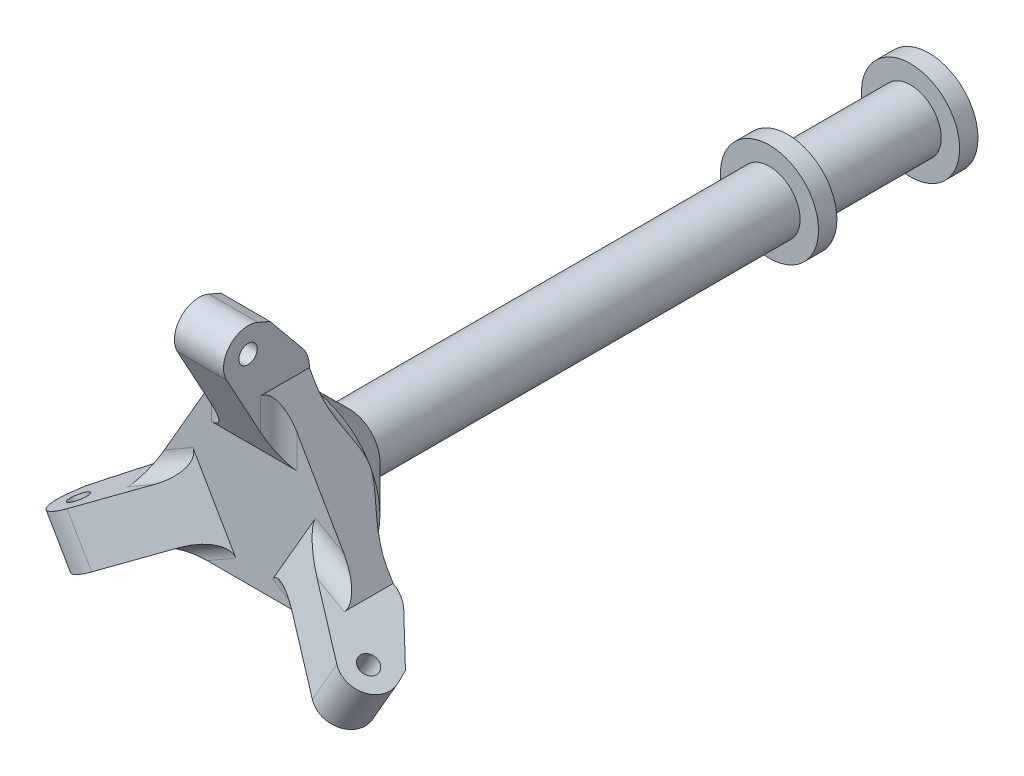
from build123d import *

# Parameters (mm, degrees)
EXTRUDE_1_DEPTH          = 5
SKETCH_3_R               = 1.5
EXTRUDE_2_DEPTH          = 4
CUT_EXTRUDE_1_DEPTH      = 112.469065397
PATTERN_CIRCULAR_1_COUNT = 3
FILLET_1_R               = 3
FILLET_2_R               = 5


with BuildPart() as part:
    # 草图1 → 旋转1 (revolve)
    with BuildSketch(Plane(origin=(0, 0, 0), x_dir=(0, 0, -1), z_dir=(1, 0, 0)), mode=Mode.PRIVATE) as revolve_1_sk:
        Polygon((0, 0), (0, 12.5), (3, 12.5), (10.5, 5), (79, 5), (79, 8), (82, 8), (82, 5), (102, 5), (102, 8), (105, 8), (105, 0), align=None)
    revolve(revolve_1_sk.sketch.rotate(Axis((0, 0, 0), (0, 0, -1)), 90), axis=Axis((0, 0, 0), (0, 0, -1)))

    # 草图2 → 凸台-拉伸1 (add)
    with BuildSketch(Plane.XY):
        Polygon((-4, 25), (4, 25), (4, 18.07179677), (17.650635095, -5.57179677), (23.650635095, -9.035898385), (19.650635095, -15.964101615), (13.650635095, -12.5), (-13.650635095, -12.5), (-19.650635095, -15.964101615), (-23.650635095, -9.035898385), (-17.650635095, -5.57179677), (-4, 18.07179677), align=None)
    extrude(amount=EXTRUDE_1_DEPTH)

    # 草图3 → 凸台-拉伸2 (add, symmetric)
    with BuildSketch(Plane(origin=(0, 0, 0), x_dir=(0, 0, -1), z_dir=(1, 0, 0))):
        with BuildLine():
            Line((-5, 7.5), (-13.510549927, 23.082700021))
            ThreePointArc((-13.510549927, 23.082700021), (-12.95059807, 27.700735275), (-8.4, 28.666060556))
            Line((-8.4, 28.666060556), (0, 25))
            Line((0, 25), (-5, 25))
            Line((-5, 25), (-5, 7.5))
        make_face()
        with Locations((-10, 25)):
            Circle(SKETCH_3_R, mode=Mode.SUBTRACT)
    extrude_2 = extrude(amount=EXTRUDE_2_DEPTH, both=True)

    # 草图5 → 切除-拉伸1 (cut, symmetric)
    with BuildSketch(Plane(origin=(0, 0, 0), x_dir=(0, 0, -1), z_dir=(1, 0, 0))):
        Polygon((0, 20), (-6.415605973, 27.8), (0, 25), align=None)
    cut_extrude_1 = extrude(amount=CUT_EXTRUDE_1_DEPTH, both=True, mode=Mode.SUBTRACT)

    # 阵列(圆周)1: 凸台-拉伸2, 切除-拉伸1 ×3 about axis
    pattern_circular_1_axis = Axis((0, 0, 0), (0, 0, 1))
    add([extrude_2.rotate(pattern_circular_1_axis, i * 360 / PATTERN_CIRCULAR_1_COUNT) for i in range(1, PATTERN_CIRCULAR_1_COUNT)])
    add([cut_extrude_1.rotate(pattern_circular_1_axis, i * 360 / PATTERN_CIRCULAR_1_COUNT) for i in range(1, PATTERN_CIRCULAR_1_COUNT)], mode=Mode.SUBTRACT)

    # 圆角1
    # the kernel refuses this fillet: 3 mm, written as the material it adds along each edge
    with BuildSketch(Plane(origin=(20.145825623, -16.25, 5), x_dir=(0, 0, 1), z_dir=(-0.8660254037844384, 0.5000000000000004, 0))) as fillet_1_piece_1_section:
        with BuildLine():
            CenterArc((FILLET_1_R, -FILLET_1_R), FILLET_1_R, 90, 90)
            Line((0, -FILLET_1_R), (0, 0))
            Line((0, 0), (FILLET_1_R, 0))
        make_face()
    fillet_1_piece_1 = extrude(amount=25.57179677, mode=Mode.PRIVATE)
    fillet_1_piece_1 = split(fillet_1_piece_1, bisect_by=Plane(origin=(20.145825623, -12.5, 5), z_dir=(0, 1, 0)), keep=Keep.TOP, mode=Mode.PRIVATE)
    fillet_1_piece_1 = split(fillet_1_piece_1, bisect_by=Plane(origin=(16.550053856, -14.173980202, 12.602327469), z_dir=(0.4151076221534179, -0.23966249739294157, -0.877637481750588)), keep=Keep.TOP, mode=Mode.PRIVATE)
    add(fillet_1_piece_1)
    with BuildSketch(Plane(origin=(24.145825623, -9.32179677, 5), x_dir=(0, 0, 1), z_dir=(-0.8660254037844384, 0.5000000000000004, 0))) as fillet_1_piece_2_section:
        with BuildLine():
            CenterArc((FILLET_1_R, FILLET_1_R), FILLET_1_R, 180, 90)
            Line((0, FILLET_1_R), (0, 0))
            Line((0, 0), (FILLET_1_R, 0))
        make_face()
    fillet_1_piece_2 = extrude(amount=25.57179677, mode=Mode.PRIVATE)
    fillet_1_piece_2 = split(fillet_1_piece_2, bisect_by=Plane(origin=(20.550053856, -7.245776972, 12.602327469), z_dir=(0.4151076221534179, -0.23966249739294157, -0.877637481750588)), keep=Keep.TOP, mode=Mode.PRIVATE)
    fillet_1_piece_2 = split(fillet_1_piece_2, bisect_by=Plane(origin=(20.898230359, -11.19679677, 5), z_dir=(-0.8660254037844386, -0.5000000000000001, 0)), keep=Keep.TOP, mode=Mode.PRIVATE)
    add(fillet_1_piece_2)
    with BuildSketch(Plane(origin=(4, 25.57179677, 5), x_dir=(0, 0, 1), z_dir=(0, -1, 0))) as fillet_1_piece_3_section:
        with BuildLine():
            CenterArc((FILLET_1_R, -FILLET_1_R), FILLET_1_R, 90, 90)
            Line((0, -FILLET_1_R), (0, 0))
            Line((0, 0), (FILLET_1_R, 0))
        make_face()
    fillet_1_piece_3 = extrude(amount=25.57179677, mode=Mode.PRIVATE)
    fillet_1_piece_3 = split(fillet_1_piece_3, bisect_by=Plane(origin=(0.752404736, 23.69679677, 5), z_dir=(-0.8660254037844386, -0.5000000000000001, 0)), keep=Keep.TOP, mode=Mode.PRIVATE)
    fillet_1_piece_3 = split(fillet_1_piece_3, bisect_by=Plane(origin=(4, 21.419757175, 12.602327469), z_dir=(0, 0.4793249947858827, -0.877637481750588)), keep=Keep.TOP, mode=Mode.PRIVATE)
    add(fillet_1_piece_3)
    with BuildSketch(Plane(origin=(-4, 25.57179677, 5), x_dir=(0, 0, 1), z_dir=(0, -1, 0))) as fillet_1_piece_4_section:
        with BuildLine():
            CenterArc((FILLET_1_R, FILLET_1_R), FILLET_1_R, 180, 90)
            Line((0, FILLET_1_R), (0, 0))
            Line((0, 0), (FILLET_1_R, 0))
        make_face()
    fillet_1_piece_4 = extrude(amount=25.57179677, mode=Mode.PRIVATE)
    fillet_1_piece_4 = split(fillet_1_piece_4, bisect_by=Plane(origin=(-0.752404736, 23.69679677, 5), z_dir=(0.8660254037844388, -0.4999999999999999, 0)), keep=Keep.TOP, mode=Mode.PRIVATE)
    fillet_1_piece_4 = split(fillet_1_piece_4, bisect_by=Plane(origin=(-4, 21.419757175, 12.602327469), z_dir=(0, 0.4793249947858827, -0.877637481750588)), keep=Keep.TOP, mode=Mode.PRIVATE)
    add(fillet_1_piece_4)
    with BuildSketch(Plane(origin=(-24.145825623, -9.32179677, 5), x_dir=(0, 0, 1), z_dir=(0.8660254037844388, 0.49999999999999983, 0))) as fillet_1_piece_5_section:
        with BuildLine():
            CenterArc((FILLET_1_R, -FILLET_1_R), FILLET_1_R, 90, 90)
            Line((0, -FILLET_1_R), (0, 0))
            Line((0, 0), (FILLET_1_R, 0))
        make_face()
    fillet_1_piece_5 = extrude(amount=25.57179677, mode=Mode.PRIVATE)
    fillet_1_piece_5 = split(fillet_1_piece_5, bisect_by=Plane(origin=(-20.898230359, -11.19679677, 5), z_dir=(0.8660254037844388, -0.4999999999999999, 0)), keep=Keep.TOP, mode=Mode.PRIVATE)
    fillet_1_piece_5 = split(fillet_1_piece_5, bisect_by=Plane(origin=(-20.550053856, -7.245776972, 12.602327469), z_dir=(-0.4151076221534181, -0.23966249739294126, -0.8776374817505879)), keep=Keep.TOP, mode=Mode.PRIVATE)
    add(fillet_1_piece_5)
    with BuildSketch(Plane(origin=(-20.145825623, -16.25, 5), x_dir=(0, 0, 1), z_dir=(0.8660254037844388, 0.49999999999999983, 0))) as fillet_1_piece_6_section:
        with BuildLine():
            CenterArc((FILLET_1_R, FILLET_1_R), FILLET_1_R, 180, 90)
            Line((0, FILLET_1_R), (0, 0))
            Line((0, 0), (FILLET_1_R, 0))
        make_face()
    fillet_1_piece_6 = extrude(amount=25.57179677, mode=Mode.PRIVATE)
    fillet_1_piece_6 = split(fillet_1_piece_6, bisect_by=Plane(origin=(-20.145825623, -12.5, 5), z_dir=(0, 1, 0)), keep=Keep.TOP, mode=Mode.PRIVATE)
    fillet_1_piece_6 = split(fillet_1_piece_6, bisect_by=Plane(origin=(-16.550053856, -14.173980202, 12.602327469), z_dir=(-0.4151076221534181, -0.23966249739294126, -0.8776374817505879)), keep=Keep.TOP, mode=Mode.PRIVATE)
    add(fillet_1_piece_6)

    # 圆角2
    # the kernel refuses this fillet: 5 mm, written as the material it adds along each edge
    with BuildSketch(Plane(origin=(0, 0, 0), x_dir=(-0.8660253934759007, 0.5000000178549112, 0), z_dir=(-0.5000000178549112, -0.8660253934759007, 0))) as fillet_2_piece_1_section:
        with BuildLine():
            CenterArc((17.082575695, 5), FILLET_2_R, 203.578178478, 66.421821522)
            Line((17.082575695, 0), (12.5, 0))
            Line((12.5, 0), (12.5, 3))
        make_face()
    fillet_2_piece_1 = revolve(axis=Axis((0, 0, 0), (0, 0, -1)), revolution_arc=119.999998782, mode=Mode.PRIVATE)
    fillet_2_piece_1 = split(fillet_2_piece_1, bisect_by=Plane(origin=(-10.825317547, 6.25, 0), z_dir=(0.866025403784329, -0.50000000000019, 0)), keep=Keep.TOP, mode=Mode.PRIVATE)
    fillet_2_piece_1 = split(fillet_2_piece_1, bisect_by=Plane(origin=(10.825317547, 6.25, 0), z_dir=(-0.866025403784329, -0.50000000000019, 0)), keep=Keep.TOP, mode=Mode.PRIVATE)
    add(fillet_2_piece_1)
    with BuildSketch(Plane(origin=(0, 0, 0), x_dir=(3.791753972085742e-09, -1.0, 0), z_dir=(1.0, 3.791753972085742e-09, 0))) as fillet_2_piece_2_section:
        with BuildLine():
            CenterArc((17.082575695, 5), FILLET_2_R, 203.578178478, 66.421821522)
            Line((12.5, 3), (12.5, 0))
            Line((12.5, 0), (17.082575695, 0))
        make_face()
    fillet_2_piece_2 = revolve(axis=Axis((0, 0, 0), (0, 0, -1)), revolution_arc=120.000001399, mode=Mode.PRIVATE)
    fillet_2_piece_2 = split(fillet_2_piece_2, bisect_by=Plane(origin=(-10.825317547, 6.25, 0), z_dir=(0.866025403784329, -0.50000000000019, 0)), keep=Keep.TOP, mode=Mode.PRIVATE)
    fillet_2_piece_2 = split(fillet_2_piece_2, bisect_by=Plane(origin=(0, -12.5, 0), z_dir=(0, 1, 0)), keep=Keep.TOP, mode=Mode.PRIVATE)
    add(fillet_2_piece_2)
    with BuildSketch(Plane(origin=(0, 0, 0), x_dir=(1, 0, 0), z_dir=(0, 1, 0))) as fillet_2_piece_3_section:
        with BuildLine():
            CenterArc((17.082575695, 5), FILLET_2_R, 203.578178478, 66.421821522)
            Line((17.082575695, 0), (12.5, 0))
            Line((12.5, 0), (12.5, 3))
        make_face()
    fillet_2_piece_3 = revolve(axis=Axis((0, 0, 0), (0, 0, -1)), revolution_arc=89.999999783, mode=Mode.PRIVATE)
    fillet_2_piece_3 = split(fillet_2_piece_3, bisect_by=Plane(origin=(10.825317547, 6.25, 0), z_dir=(-0.866025403784329, -0.50000000000019, 0)), keep=Keep.TOP, mode=Mode.PRIVATE)
    fillet_2_piece_3 = split(fillet_2_piece_3, bisect_by=Plane(origin=(0, -12.5, 0), z_dir=(0, 1, 0)), keep=Keep.TOP, mode=Mode.PRIVATE)
    add(fillet_2_piece_3)
    with BuildSketch(Plane(origin=(0, 0, 0), x_dir=(0.8660254034677206, 0.5000000005485719, 0), z_dir=(-0.5000000005485719, 0.8660254034677206, 0))) as fillet_2_piece_4_section:
        with BuildLine():
            CenterArc((17.082575695, 5), FILLET_2_R, 203.578178478, 66.421821522)
            Line((17.082575695, 0), (12.5, 0))
            Line((12.5, 0), (12.5, 3))
        make_face()
    fillet_2_piece_4 = revolve(axis=Axis((0, 0, 0), (0, 0, -1)), revolution_arc=30.000000036, mode=Mode.PRIVATE)
    fillet_2_piece_4 = split(fillet_2_piece_4, bisect_by=Plane(origin=(10.825317547, 6.25, 0), z_dir=(-0.866025403784329, -0.50000000000019, 0)), keep=Keep.TOP, mode=Mode.PRIVATE)
    add(fillet_2_piece_4)
    # the kernel refuses this fillet: 5 mm, written as the material it takes off along each edge
    with BuildSketch(Plane(origin=(-13.080360235, -17.344151491, 0), x_dir=(0.8660254037844387, 0.49999999999999983, 0), z_dir=(-0.49999999999999983, 0.8660254037844388, 0)), Plane(origin=(-8.480295681, 20, 0), x_dir=(0, -1, 0), z_dir=(1, 0, 0))) as fillet_2_2_piece_1:
        with BuildLine():
            CenterArc((FILLET_2_R * 0.358423654455, -FILLET_2_R), FILLET_2_R, 90, 39.437761058)
            Line((-FILLET_2_R * 0.276815994626, -FILLET_2_R * 0.227684916478), (0, 0))
            Line((0, 0), (FILLET_2_R * 0.358423654455, 0))
        make_face()
    extrude(amount=16.960591361, mode=Mode.SUBTRACT)
    with BuildSketch(Plane(origin=(21.560655916, -2.655848509, 0), x_dir=(0.6688444820557844, -0.38615754176090344, 0.6352396490811208), z_dir=(-0.5000000000000004, -0.8660254037844384, 0))) as fillet_2_2_piece_2:
        with BuildLine():
            CenterArc((FILLET_2_R * 0.358423654455, FILLET_2_R), FILLET_2_R, 230.562238942, 39.437761058)
            Line((-FILLET_2_R * 0.276815994626, FILLET_2_R * 0.227684916478), (0, 0))
            Line((0, 0), (FILLET_2_R * 0.358423654455, 0))
        make_face()
    extrude(amount=16.960591361, mode=Mode.SUBTRACT)


solid = part.part
